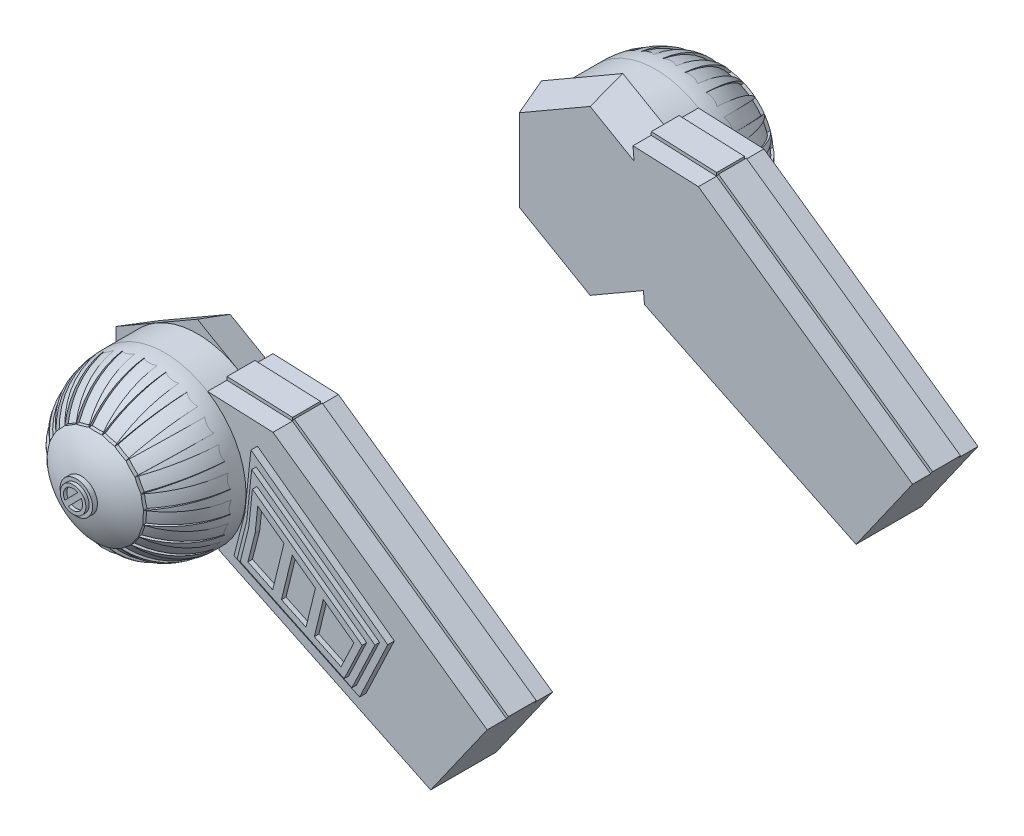
from build123d import *

# Parameters (mm, degrees)
BOSS_EXTRUDE8_DEPTH       = 25.4
SKETCH8_R                 = 31.562311244
BOSS_EXTRUDE4_DEPTH       = 12.7
SKETCH9_R                 = 6.296860476
BOSS_EXTRUDE5_DEPTH       = 59.69
SKETCH10_R                = 4.966059603
BOSS_EXTRUDE6_DEPTH       = 1.27
CUT_EXTRUDE3_REACH        = 176.634
CUT_EXTRUDE3_START_RADIUS = 31.594486539
CUT_EXTRUDE3_END_RADIUS   = 31.594486539
CIRPATTERN8_COUNT         = 23
CIRPATTERN8_ANGLE         = 344
SKETCH13_W                = 101.6
SKETCH13_H                = 10.805663742
BOSS_EXTRUDE9_DEPTH       = 1.27
BOSS_EXTRUDE10_DEPTH      = 2.54
BOSS_EXTRUDE11_DEPTH      = 1.778
BOSS_EXTRUDE12_DEPTH      = 1.778
SKETCH17_W                = 25.419527821
SKETCH17_H                = 10.805663742
BOSS_EXTRUDE13_DEPTH      = 1.27


# Read off the part's stored shape, not the designer's step: Dome2
with BuildPart() as part:
    # Sketch7 → Loft2 section 0
    with BuildSketch(Plane.XY.offset(12.7)):
        with BuildLine():
            Line((0, 36.445017786), (-31.562311244, 18.222508893))
            Line((-31.562311244, 18.222508893), (-31.562311244, -18.222508893))
            Line((-31.562311244, -18.222508893), (0, -36.445017786))
            Line((0, -36.445017786), (31.562311244, -18.222508893))
            Line((31.562311244, -18.222508893), (31.562311244, 18.222508893))
            Line((31.562311244, 18.222508893), (0, 36.445017786))
        make_face()
    # Sketch1 → Loft2 section 1
    with BuildSketch(Plane.XY):
        with BuildLine():
            Line((27.49630657, 15.875), (0, 31.75))
            Line((0, 31.75), (-27.49630657, 15.875))
            Line((-27.49630657, 15.875), (-27.49630657, -15.875))
            Line((-27.49630657, -15.875), (0, -31.75))
            Line((0, -31.75), (27.49630657, -15.875))
            Line((27.49630657, -15.875), (27.49630657, 15.875))
        make_face()
    loft()

    # Sketch8 → Boss-Extrude4 (add)
    with BuildSketch(Plane.XY.offset(12.7)):
        Circle(SKETCH8_R)
    extrude(amount=BOSS_EXTRUDE4_DEPTH)

    # Dome2 outline → Dome2 (revolve)
    with BuildSketch(Plane.XZ):
        with BuildLine():
            Line((0, 58.42), (0, 25.399999968))
            Line((0, 25.399999968), (31.562311242, 25.399999968))
            ThreePointArc((31.562311242, 25.399999968), (22.839110606, 48.656377081), (0, 58.42))
        make_face()
    revolve(axis=Axis((0, 0, 0), (0, 0, 1)))

    # Sketch9 → Boss-Extrude5 (add)
    with BuildSketch(Plane.XY):
        Circle(SKETCH9_R)
    extrude(amount=BOSS_EXTRUDE5_DEPTH)

    # Sketch10 → Boss-Extrude6 (add)
    with BuildSketch(Plane.XY.offset(59.69)):
        Circle(SKETCH10_R)
        with BuildLine():
            Line((1.821452192, 3.219670483), (-3.187259111, -1.877590334))
            ThreePointArc((-3.187259111, -1.877590334), (-2.638536355, 2.592699753), (1.821452192, 3.219670483))
        make_face(mode=Mode.SUBTRACT)
        with BuildLine():
            Line((3.187259111, 1.877590334), (-1.821452192, -3.219670483))
            ThreePointArc((-1.821452192, -3.219670483), (2.638536355, -2.592699753), (3.187259111, 1.877590334))
        make_face(mode=Mode.SUBTRACT)
    extrude(amount=BOSS_EXTRUDE6_DEPTH)

    # Cut-Extrude3: from a sphere face, 176.634 long prism both ways, kept between that surface and its translate by the depth
    cut_extrude3_start = Location((0, 0, 26.825513461)) * Sphere(CUT_EXTRUDE3_START_RADIUS, mode=Mode.PRIVATE)
    cut_extrude3_end = Location((0, 0, 25.555513461)) * Sphere(CUT_EXTRUDE3_END_RADIUS, mode=Mode.PRIVATE)
    # Sketch11 → Cut-Extrude3 (cut, from a surface)
    with BuildSketch(Plane.XY.offset(101.6), mode=Mode.PRIVATE) as cut_extrude3_sk1:
        Polygon((-2.54, 18.591821347), (0, 18.591821347), (2.54, 18.591821347), (2.54, 31.236508203), (-2.54, 31.236508203), align=None)
    cut_extrude3_tool1 = extrude(cut_extrude3_sk1.sketch, amount=CUT_EXTRUDE3_REACH, both=True, mode=Mode.PRIVATE)
    cut_extrude3 = ((cut_extrude3_tool1 & cut_extrude3_start) - cut_extrude3_end).solids().sort_by_distance((0, 24.914165, 40.965631))[0]
    add(cut_extrude3, mode=Mode.SUBTRACT)

    # CirPattern8: Cut-Extrude3 ×23 about axis
    cirpattern8_axis = Axis((0, 0, 0), (0, 0, -1))
    for i in range(1, CIRPATTERN8_COUNT):
        add(cut_extrude3.rotate(cirpattern8_axis, i * CIRPATTERN8_ANGLE / (CIRPATTERN8_COUNT - 1)), mode=Mode.SUBTRACT)



with BuildPart() as body_2:
    # Sketch12 → Boss-Extrude8 (new body)
    with BuildSketch(Plane.XY):
        Polygon((16.632133964, 26.842450764), (42.032133964, 25.785662588), (125.130885893, -32.670794949), (103.209714317, -63.832826922), (21.087138489, -24.270352703), align=None)
    extrude(amount=BOSS_EXTRUDE8_DEPTH)

    # Sketch13 → Boss-Extrude9 (add)
    with BuildSketch(Plane(origin=(26.048612558, 37.029393916, 0), x_dir=(0.8179011016683436, -0.5753588340242201, 0), z_dir=(0.5753588340242201, 0.8179011016683436, 0))):
        with Locations((70.342119913, -12.455754132)):
            Rectangle(SKETCH13_W, SKETCH13_H)
    extrude(amount=BOSS_EXTRUDE9_DEPTH)


with BuildPart() as part_1:
    add(part.part)

    add(body_2.part)  # Boss-Extrude10 merges body 2
    # Sketch14 → Boss-Extrude10 (add)
    with BuildSketch(Plane.XY.offset(25.4)):
        Polygon((36.009736297, 18.111026902), (33.674728804, -4.118244431), (29.471715317, -20.74349778), (78.159330778, -43.851096525), (89.108204582, -20.781864477), align=None)
    extrude(amount=BOSS_EXTRUDE10_DEPTH)

    # Sketch15 → Boss-Extrude11 (add)
    with BuildSketch(Plane.XY.offset(27.94)):
        Polygon((85.913086771, -21.590026907), (38.074152116, 13.450428106), (36.181831064, -4.564468307), (32.445591617, -19.343371007), (76.953731552, -40.467351483), align=None)
    extrude(amount=BOSS_EXTRUDE11_DEPTH)

    # Sketch16 → Boss-Extrude12 (add)
    with BuildSketch(Plane.XY.offset(29.718)):
        Polygon((75.748132325, -37.083606442), (82.717968959, -22.398189336), (40.138567934, 8.789829311), (38.688933324, -5.010692183), (35.419467918, -17.943244233), align=None)
        Polygon((79.522851148, -23.206351766), (67.656289807, -14.514483692), (64.166216975, -28.77516449), (74.542533098, -33.699861401), align=None, mode=Mode.SUBTRACT)
        Polygon((42.202983753, 4.129230515), (41.196035584, -5.456916059), (38.393344218, -16.543117459), (48.022461539, -21.113186813), (52.376447049, -3.322498615), align=None, mode=Mode.SUBTRACT)
        Polygon((55.594708874, -5.679770146), (51.42268186, -22.726963254), (60.925838702, -27.237250583), (64.589316284, -12.268025895), align=None, mode=Mode.SUBTRACT)
    extrude(amount=BOSS_EXTRUDE12_DEPTH)

    # Sketch17 → Boss-Extrude13 (add)
    with BuildSketch(Plane(origin=(1.143613874, 27.486863556, 0), x_dir=(0.9991355993761982, -0.041569869607266614, 0), z_dir=(0.041569869607266614, 0.9991355993761983, 0))):
        with Locations((28.214130819, -12.455754132)):
            Rectangle(SKETCH17_W, SKETCH17_H)
    extrude(amount=BOSS_EXTRUDE13_DEPTH)


with BuildPart() as body_2_2:
    # Mirror3: mirrored copy
    add(part_1.part.mirror(Plane.XY.offset(-69.85)))


solid = Compound([part_1.part, body_2_2.part])
